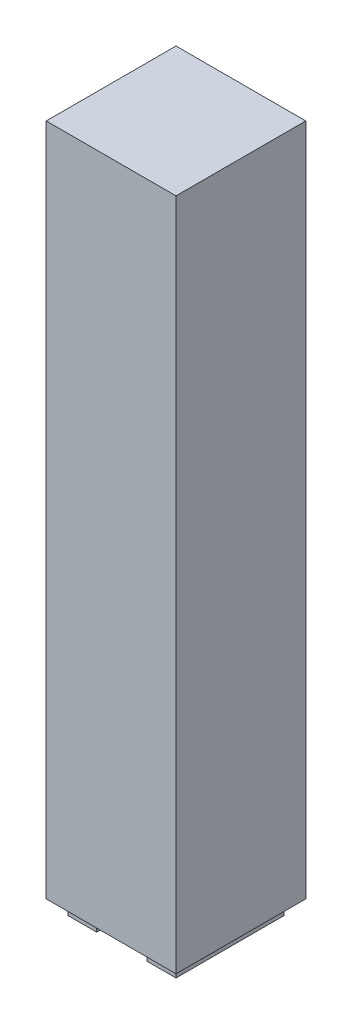
from build123d import *

# Parameters (mm, degrees)
SKETCH1_W           = 36
SKETCH1_H           = 36
BOSS_EXTRUDE1_DEPTH = 186.9
BOSS_EXTRUDE2_DEPTH = 4
SKETCH3_R           = 2
CUT_EXTRUDE1_DEPTH  = 5


with BuildPart() as part:
    # Sketch1 → Boss-Extrude1 (new body)
    with BuildSketch(Plane(origin=(0, 0, 0), x_dir=(1, 0, 0), z_dir=(0, 1, 0))):
        with Locations((18, 18)):
            Rectangle(SKETCH1_W, SKETCH1_H)
    extrude(amount=BOSS_EXTRUDE1_DEPTH)

    # Sketch2 → Boss-Extrude2 (add)
    with BuildSketch(Plane.XZ):
        Polygon((3, -3), (7, -3), (11, -3), (11, -11), (7, -11), (7, -25), (11, -25), (11, -33), (7, -33), (3, -33), align=None)
        Polygon((29, -3), (33, -3), (33, -33), (29, -33), (25, -33), (25, -25), (29, -25), (29, -11), (25, -11), (25, -3), align=None)
    extrude(amount=BOSS_EXTRUDE2_DEPTH)

    # Sketch3 → Cut-Extrude1 (cut)
    with BuildSketch(Plane.XZ):
        with Locations((18, -18)):
            Circle(SKETCH3_R)
    extrude(amount=-CUT_EXTRUDE1_DEPTH, mode=Mode.SUBTRACT)


solid = part.part
